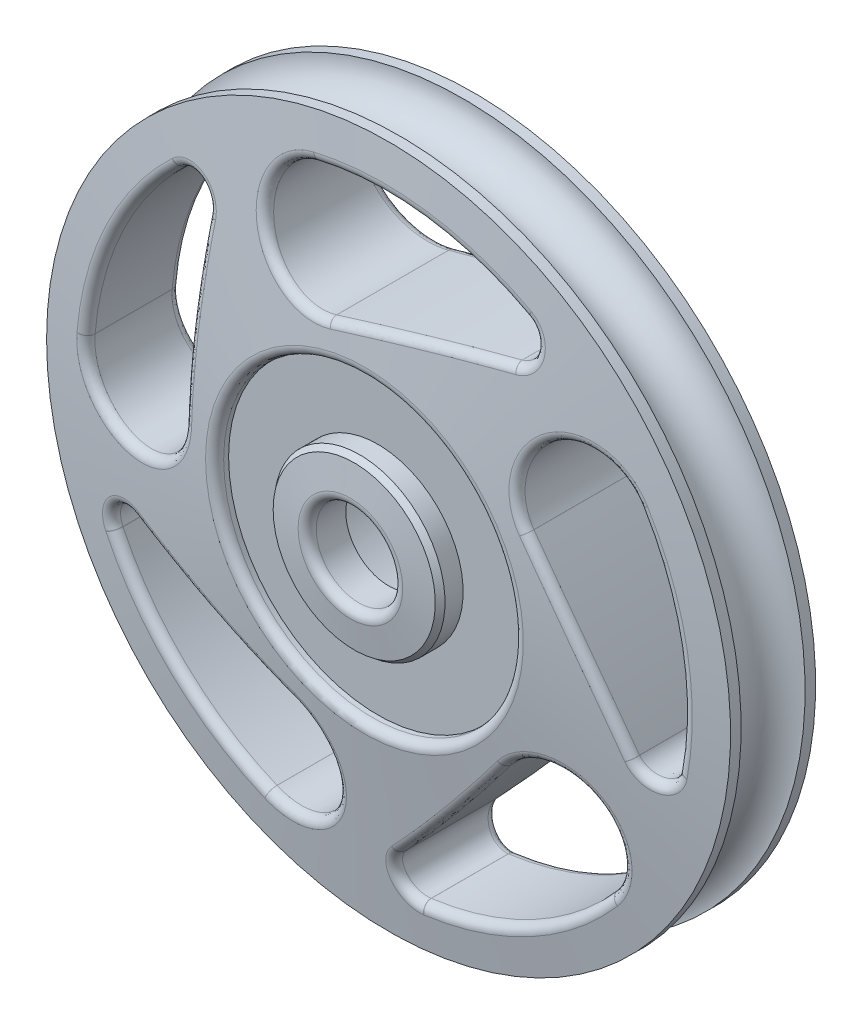
from build123d import *

# Parameters (mm, degrees)
CUT_EXTRUDE1_DEPTH       = 147.026172593
FILLET1_R                = 2.54
CIRPATTERN1_COUNT        = 5
FILLET1_OF_CIRPATTERN1_R = 2.54


with BuildPart() as part:
    # Revolve1: read off the stored shape, not the designer's step
    # Revolve1 outline → Revolve1 (revolve)
    with BuildSketch(Plane.XZ):
        with BuildLine():
            Line((101.846346007, 9.525), (101.846346007, 12.667567933))
            Line((101.846346007, 12.667567933), (47.321536528, 19.845895281))
            ThreePointArc((47.321536528, 19.845895281), (45.31526163, 19.237298444), (44.45, 17.327625333))
            Line((44.45, 17.327625333), (44.45, 15.86382957))
            Line((44.45, 15.86382957), (25.4, 15.86382957))
            Line((25.4, 15.86382957), (25.4, 21.256751934))
            Line((25.4, 21.256751934), (24.140865026, 22.89768858))
            Line((24.140865026, 22.89768858), (15.571536528, 24.02586208))
            ThreePointArc((15.571536528, 24.02586208), (13.56526163, 23.417265243), (12.7, 21.507592132))
            Line((12.7, 21.507592132), (12.7, 12.7))
            Line((12.7, 12.7), (29.21, 12.7))
            ThreePointArc((29.21, 12.7), (31.006051224, 11.956051224), (31.75, 10.16))
            Line((31.75, 10.16), (31.75, -18.999612053))
            ThreePointArc((31.75, -18.999612053), (32.61526163, -20.909285164), (34.621536528, -21.517882001))
            Line((34.621536528, -21.517882001), (101.846346007, -12.667567933))
            Line((101.846346007, -12.667567933), (101.846346007, -9.525))
            ThreePointArc((101.846346007, -9.525), (92.321346007, 0), (101.846346007, 9.525))
        make_face()
    revolve(axis=Axis((0, 0, 0), (0, 0, 1)))

    # Sketch3 → Cut-Extrude1 (cut, symmetric)
    with BuildSketch(Plane.XY):
        with BuildLine():
            ThreePointArc((42.490757305, 78.088062748), (11.850143042, 88.106663255), (-20.348686287, 86.539823009))
            add(Edge.make_bspline(
                [(-20.348686287, 86.539823009), (-20.487704528, 86.506072724), (-20.765858631, 86.438543598), (-21.179880802, 86.323997275), (-21.591437836, 86.199755853), (-22.000038989, 86.064918024), (-22.676370833, 85.82283832), (-23.473825351, 85.491247381), (-24.378724573, 85.046305064), (-25.135725304, 84.625400093), (-25.748754424, 84.242772347), (-26.227692344, 83.917954121), (-26.921599523, 83.421232165), (-27.915119631, 82.612388911), (-29.129758345, 81.404674156), (-30.229719844, 80.066260628), (-31.1869027, 78.625632687), (-31.995523613, 77.093903726), (-32.857527603, 74.970074548), (-33.44089042, 72.529307255), (-33.61783958, 69.898290756), (-33.473639745, 67.615687473), (-32.9586141, 65.012644136), (-32.062406488, 62.661442951), (-30.942817523, 60.677186905), (-29.629763467, 58.811864247), (-27.651205564, 56.741543553), (-24.828203436, 54.774299125), (-22.177488597, 53.627086339), (-19.960932111, 53.044540292), (-18.2555619, 52.774355483), (-16.544649809, 52.676416602), (-15.162226376, 52.736626421), (-14.139095231, 52.853326051), (-13.457160417, 52.958917991), (-12.781057114, 53.092177727), (-12.11109863, 53.250384026), (-11.670833321, 53.378291377), (-11.450835647, 53.442205838)],
                knots=[0, 0, 0, 0, 0.007769599, 0.015545771, 0.02332859, 0.031118129, 0.038914458, 0.062344917, 0.0780005, 0.09368497, 0.109398897, 0.117267082, 0.125142843, 0.155797668, 0.186823804, 0.218225105, 0.250005285, 0.280962527, 0.312586706, 0.375045772, 0.417207939, 0.456707552, 0.500180828, 0.56250785, 0.593979758, 0.625259314, 0.687721223, 0.750189046, 0.812772132, 0.844538578, 0.875061672, 0.906689141, 0.937627241, 0.950136121, 0.962626892, 0.975100496, 0.987557882, 1, 1, 1, 1], degree=3))
            add(Edge.make_bspline(
                [(-11.450835647, 53.442205838), (-10.851393958, 53.623207167), (-9.647896445, 53.986603063), (-7.833306037, 54.525219647), (-6.003097665, 55.061561591), (-4.157073566, 55.594849259), (-2.295263629, 56.12508594), (-0.417635504, 56.652061415), (2.946842628, 57.582371989), (7.902258284, 58.907942705), (13.306748937, 60.277403927), (17.701176638, 61.344233728), (20.945809068, 62.109293239), (24.226902579, 62.860175384), (27.44622615, 63.574576847), (30.670239275, 64.26820461), (33.898639705, 64.940799429), (37.235223426, 65.614694329), (39.497744814, 66.051311757), (40.646509048, 66.272998274)],
                knots=[0, 0, 0, 0, 0.034928805, 0.070126471, 0.105593616, 0.141330843, 0.177338743, 0.213617895, 0.250168861, 0.372181905, 0.500026026, 0.561644172, 0.624943168, 0.686413678, 0.749894289, 0.809426718, 0.870954801, 0.934479069, 1, 1, 1, 1], degree=3))
            add(Edge.make_bspline(
                [(40.646509048, 66.272998274), (40.731323561, 66.29023324), (40.903104788, 66.325140516), (41.160667753, 66.391681838), (41.421460756, 66.470138986), (41.684556112, 66.562145286), (41.949229188, 66.668036353), (42.214616286, 66.788472443), (42.529237967, 66.949234007), (42.894690005, 67.164781565), (43.286162376, 67.43814955), (43.66646367, 67.749001287), (44.13459476, 68.195288719), (44.658462013, 68.826714977), (45.158185316, 69.660906771), (45.525763647, 70.563212657), (45.826747705, 71.823267744), (45.832891266, 73.148665683), (45.538834531, 74.41699012), (45.173719694, 75.328733733), (44.67796656, 76.166923597), (44.158129336, 76.799059369), (43.690518726, 77.250647912), (43.312407686, 77.562323851), (42.913801539, 77.845569808), (42.631633939, 78.007310934), (42.490757305, 78.088062748)],
                knots=[0, 0, 0, 0, 0.016642758, 0.033707832, 0.051195816, 0.069107262, 0.087442681, 0.106202551, 0.125387319, 0.155730569, 0.188239252, 0.217798384, 0.250896829, 0.313627883, 0.376451841, 0.439021292, 0.501891036, 0.626662636, 0.690243074, 0.751402868, 0.814233631, 0.875775747, 0.906979542, 0.938081079, 0.969086, 1, 1, 1, 1], degree=3))
        make_face()
    cut_extrude1 = extrude(amount=CUT_EXTRUDE1_DEPTH, both=True, mode=Mode.SUBTRACT)

    # Fillet1
    fillet1_edges = [part.edges().sort_by_distance(p)[0] for p in [
        (14.455974431, 60.552695863, 17.879953008),
        (45.727055377, 71.514021872, 14.900760953),
        (11.850143043, 88.106663264, 14.371986719),
        (-32.976632245, 65.381075696, 16.435421437),
        (-32.976632245, 65.381075696, -16.435421437),
        (-11.450835647, 53.442205838, 9.440200015),
        (11.850143043, 88.106663264, -14.37198672),
        (-20.348686287, 86.539823009, 7.18599336),
        (45.727055377, 71.514021872, -14.900760953),
        (42.490757305, 78.088062748, 7.18599336),
        (14.455974431, 60.552695863, -17.879953008),
        (40.646509048, 66.272998274, 7.920300417),
    ]]
    fillet(fillet1_edges, radius=FILLET1_R)

    # CirPattern1: Cut-Extrude1 ×5 about axis
    cirpattern1_axis = Axis((0, 0, -25.349612053), (0, 0, -1))
    for i in range(1, CIRPATTERN1_COUNT):
        add(cut_extrude1.rotate(cirpattern1_axis, i * 360 / CIRPATTERN1_COUNT), mode=Mode.SUBTRACT)

    # Fillet1 of CirPattern1
    fillet1_of_cirpattern1_edges = [part.edges().sort_by_distance(p)[0] for p in [
        (62.05617775, 4.963363395, 17.879953008),
        (82.144313722, -21.389965892, 14.900760953),
        (87.456311813, 15.956300506, 14.371986719),
        (51.990758302, 51.566504483, 16.435421437),
        (51.990758302, 51.566504483, -16.435421437),
        (47.288055292, 27.40494168, 9.440200015),
        (87.456311813, 15.956300506, -14.37198672),
        (76.016172716, 46.095026691, 7.18599336),
        (82.144313722, -21.389965892, -14.900760953),
        (87.396527032, -16.28057317, 7.18599336),
        (62.05617775, 4.963363395, -17.879953008),
        (75.58982892, -18.17764456, 7.920300417),
        (23.89685263, -57.485168587, 17.879953008),
        (5.040922486, -84.733747812, 14.900760953),
        (42.200830188, -78.245127217, 14.371986719),
        (65.108687977, -33.511223245, 16.435421437),
        (65.108687977, -33.511223245, -16.435421437),
        (40.67646108, -36.50502042, 9.440200015),
        (42.200830188, -78.245127217, -14.37198672),
        (67.32926472, -58.051529801, 7.18599336),
        (5.040922486, -84.733747812, -14.900760953),
        (11.5232669, -88.150010323, 7.18599336),
        (23.89685263, -57.485168587, -17.879953008),
        (6.070574429, -77.507400447, 7.920300417),
        (-47.2871106, -40.491151431, 17.879953008),
        (-79.028852291, -30.97837025, 14.900760953),
        (-61.374764403, -64.31444858, 14.371986719),
        (-11.75137617, -72.277579453, 16.435421437),
        (-11.75137617, -72.277579453, -16.435421437),
        (-22.148619803, -49.966285059, 9.440200015),
        (-61.374764403, -64.31444858, -14.37198672),
        (-34.404398681, -81.972845207, 7.18599336),
        (-79.028852291, -30.97837025, -14.900760953),
        (-80.274756426, -38.199129318, 7.18599336),
        (-47.2871106, -40.491151431, -17.879953008),
        (-71.838007592, -29.724563296, 7.920300417),
        (-53.121894211, 32.460260759, 17.879953008),
        (-53.883439294, 65.588062082, 14.900760953),
        (-80.13252064, 38.496612026, 14.371986719),
        (-72.371437864, -11.158777482, 16.435421437),
        (-72.371437864, -11.158777482, -16.435421437),
        (-54.365060922, 5.624157961, 9.440200015),
        (-80.13252064, 38.496612026, -14.37198672),
        (-88.592352467, 7.389525309, 7.18599336),
        (-53.883439294, 65.588062082, -14.900760953),
        (-61.13579481, 64.541650064, 7.18599336),
        (-53.121894211, 32.460260759, -17.879953008),
        (-50.468904805, 59.136610029, 7.920300417),
    ]]
    fillet(fillet1_of_cirpattern1_edges, radius=FILLET1_OF_CIRPATTERN1_R)


solid = part.part
